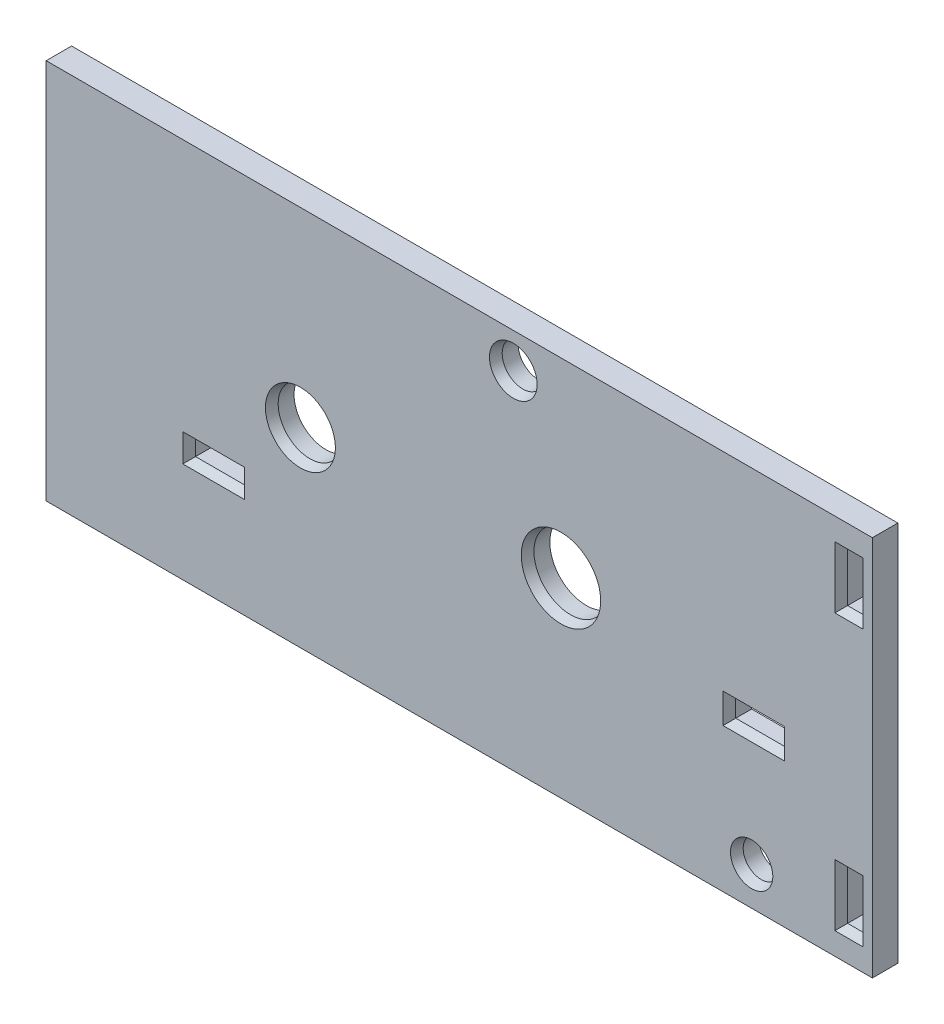
from build123d import *

# Parameters (mm, degrees)
SKETCH1_W           = 130
SKETCH1_H           = 60
SKETCH1_R           = 5
SKETCH1_R_2         = 3.25
SKETCH1_R_3         = 2.83
SKETCH1_R_4         = 5.75
SKETCH1_W_2         = 8.7
SKETCH1_H_2         = 3.4
SKETCH1_W_3         = 3.4
SKETCH1_H_3         = 8.7
SKETCH1_H_4         = 3.7
BOSS_EXTRUDE1_DEPTH = 2
CHAMFER1_SIZE       = 0.5
CHAMFER1_SIZE2      = 1.5


with BuildPart() as part:
    # Sketch1 → Boss-Extrude1 (new, symmetric)
    with BuildSketch(Plane.XY):
        with Locations((-21, 0)):
            Rectangle(SKETCH1_W, SKETCH1_H)
        with Locations((-46, 0)):
            Circle(SKETCH1_R, mode=Mode.SUBTRACT)
        with Locations((-12.5, 24.5)):
            Circle(SKETCH1_R_2, mode=Mode.SUBTRACT)
        with Locations((25, -24)):
            Circle(SKETCH1_R_3, mode=Mode.SUBTRACT)
        with Locations((-5, 0)):
            Circle(SKETCH1_R_4, mode=Mode.SUBTRACT)
        with Locations((-59.65, -12)):
            Rectangle(SKETCH1_W_2, SKETCH1_H_2, mode=Mode.SUBTRACT)
        with Locations((40.3, 21.65)):
            Rectangle(SKETCH1_W_3, SKETCH1_H_3, mode=Mode.SUBTRACT)
        with Locations((40.3, -21.65)):
            Rectangle(SKETCH1_W_3, SKETCH1_H_3, mode=Mode.SUBTRACT)
        with Locations((25.35, -5)):
            Rectangle(SKETCH1_W_2, SKETCH1_H_4, mode=Mode.SUBTRACT)
    extrude(amount=BOSS_EXTRUDE1_DEPTH, both=True)

    # Chamfer1
    chamfer1_edges = [part.edges().sort_by_distance(p)[0] for p in [
        (40.3, -26, 2),
        (42, -21.65, 2),
        (40.3, -17.3, 2),
        (38.6, -21.65, 2),
        (-10.75, 0, 2),
        (22.17, -24, 2),
        (-51, 0, 2),
        (-15.75, 24.5, 2),
        (-59.65, -13.7, 2),
        (-55.3, -12, 2),
        (-59.65, -10.3, 2),
        (-64, -12, 2),
        (25.35, -6.85, 2),
        (29.7, -5, 2),
        (25.35, -3.15, 2),
        (21, -5, 2),
        (40.3, 17.3, 2),
        (42, 21.65, 2),
        (40.3, 26, 2),
        (38.6, 21.65, 2),
    ]]
    chamfer1_side = [part.faces().sort_by_distance(p)[0] for p in [
        (-21.687400475, 0.041243407, 2),
    ]]
    chamfer(chamfer1_edges, length=CHAMFER1_SIZE, length2=CHAMFER1_SIZE2, reference=chamfer1_side[0])


solid = part.part
